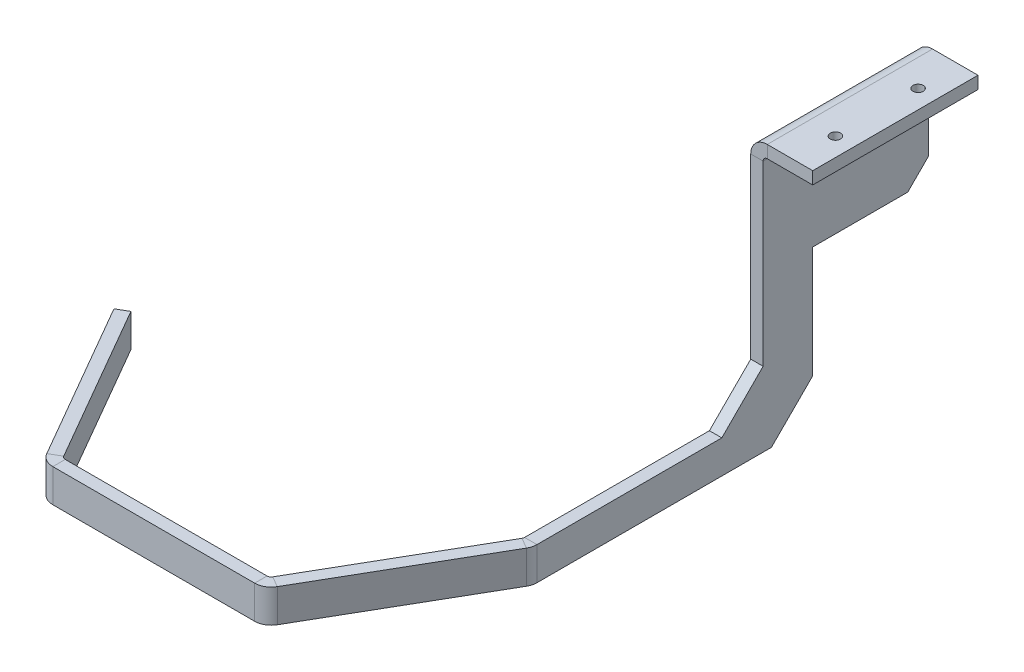
from build123d import *

# Parameters (mm, degrees)
SM_BASE_FLANGE_1_DEPTH           = 40
M3X0_5_1_D                       = 2.5
SKETCH_22_W                      = 3
SKETCH_22_H                      = 12
EXTRUDE_6_DEPTH                  = 29
SKETCH_23_W                      = 3
SKETCH_23_H                      = 67
EXTRUDE_7_DEPTH                  = 8
CHAMFER_1_SIZE                   = 10
CHAMFER_2_SIZE                   = 5
SM_EDGE_FLANGE_1_STRIP_CUT_DEPTH = 8
SM_EDGE_FLANGE_1_DEPTH           = 8
SM_EDGE_FLANGE_2_STRIP_CUT_DEPTH = 8
SM_EDGE_FLANGE_2_DEPTH           = 8
SM_EDGE_FLANGE_3_STRIP_CUT_DEPTH = 8
SM_EDGE_FLANGE_3_DEPTH           = 8


# Sheet-metal steps are written as plain solids
with BuildPart() as part:
    # 草圖3 → 基材-凸緣1 (new body)
    with BuildSketch(Plane.XY):
        with BuildLine():
            Line((12, 0), (1, 0))
            ThreePointArc((1, 0), (0.292893219, -0.292893219), (0, -1))
            Line((0, -1), (0, -25))
            Line((0, -25), (-3, -25))
            Line((-3, -25), (-3, -1))
            ThreePointArc((-3, -1), (-1.828427125, 1.828427125), (1, 3))
            Line((1, 3), (12, 3))
            Line((12, 3), (12, 0))
        make_face()
    extrude(amount=SM_BASE_FLANGE_1_DEPTH)

    # M3x0.5 螺紋孔1 (through all)
    with Locations(Plane(origin=(0, 3, 0), x_dir=(1, 0, 0), z_dir=(0, 1, 0))):
        with Locations((7.5, -30), (7.5, -10)):
            Hole(M3X0_5_1_D / 2)

    # 草圖22 → 填料-伸長6 (add)
    with BuildSketch(Plane.XZ.offset(25)):
        with Locations((-1.5, 34)):
            Rectangle(SKETCH_22_W, SKETCH_22_H)
    extrude(amount=EXTRUDE_6_DEPTH)

    # 草圖23 → 填料-伸長7 (add)
    with BuildSketch(Plane.XZ.offset(54)):
        with Locations((-1.5, 61.5)):
            Rectangle(SKETCH_23_W, SKETCH_23_H)
    extrude(amount=EXTRUDE_7_DEPTH)

    # 導角1
    chamfer_1_edges = [part.edges().sort_by_distance(p)[0] for p in [
        (-1.5, -54, 40),
        (-1.5, -62, 28),
    ]]
    chamfer(chamfer_1_edges, length=CHAMFER_1_SIZE)

    # 導角2
    chamfer_2_edges = [part.edges().sort_by_distance(p)[0] for p in [
        (-1.5, -25, 0),
    ]]
    chamfer(chamfer_2_edges, length=CHAMFER_2_SIZE)

    # 邊線-凸緣1 strip (across the edge) → 邊線-凸緣1 strip cut (cut)
    with BuildSketch(Plane(origin=(-3, -62, 95), x_dir=(-0.8660254037844416, 0, -0.49999999999999495), z_dir=(0, 1, 0))):
        Polygon((-9.464101615, 10.392304845), (-2.464101615, -1.732050808), (0.133974596, -0.232050808), (-6.866025404, 11.892304845), align=None)
    extrude(amount=SM_EDGE_FLANGE_1_STRIP_CUT_DEPTH, mode=Mode.SUBTRACT)

    # 邊線-凸緣1 section (across the edge) → 邊線-凸緣1 (add)
    with BuildSketch(Plane(origin=(-3, -62, 95), x_dir=(-0.8660254037844416, 0, -0.49999999999999495), z_dir=(0, 1, 0))):
        with BuildLine():
            Line((-3, 0.267949192), (-3, 45))
            Line((-3, 45), (0, 45))
            Line((0, 45), (0, 0.267949192))
            ThreePointArc((0, 0.267949192), (0.034074174, 0.009130147), (0.133974596, -0.232050808))
            Line((0.133974596, -0.232050808), (-2.464101615, -1.732050808))
            ThreePointArc((-2.464101615, -1.732050808), (-2.863703305, -0.767326988), (-3, 0.267949192))
        make_face()
    extrude(amount=SM_EDGE_FLANGE_1_DEPTH)

    # 邊線-凸緣2 strip (across the edge) → 邊線-凸緣2 strip cut (cut)
    with BuildSketch(Plane(origin=(-25.5, -62, 133.97114317), x_dir=(0, 0, -1), z_dir=(0, 1, 0))):
        Polygon((-13.124355653, 4.113248654), (-1, -2.886751346), (0.5, -0.288675135), (-11.624355653, 6.711324865), align=None)
    extrude(amount=SM_EDGE_FLANGE_2_STRIP_CUT_DEPTH, mode=Mode.SUBTRACT)

    # 邊線-凸緣2 section (across the edge) → 邊線-凸緣2 (add)
    with BuildSketch(Plane(origin=(-25.5, -62, 133.97114317), x_dir=(0, 0, -1), z_dir=(0, 1, 0))):
        with BuildLine():
            Line((-3, 0.577350269), (-3, 50))
            Line((-3, 50), (0, 50))
            Line((0, 50), (0, 0.577350269))
            ThreePointArc((0, 0.577350269), (0.133974596, 0.077350269), (0.5, -0.288675135))
            Line((0.5, -0.288675135), (-1, -2.886751346))
            ThreePointArc((-1, -2.886751346), (-2.464101615, -1.422649731), (-3, 0.577350269))
        make_face()
    extrude(amount=SM_EDGE_FLANGE_2_DEPTH)

    # 邊線-凸緣3 strip (across the edge) → 邊線-凸緣3 strip cut (cut)
    with BuildSketch(Plane(origin=(-75.5, -62, 133.97114317), x_dir=(0.8660254037844312, 0, -0.5000000000000132), z_dir=(0, 1, 0))):
        Polygon((-13.124355653, 4.113248654), (-1, -2.886751346), (0.5, -0.288675135), (-11.624355653, 6.711324865), align=None)
    extrude(amount=SM_EDGE_FLANGE_3_STRIP_CUT_DEPTH, mode=Mode.SUBTRACT)

    # 邊線-凸緣3 section (across the edge) → 邊線-凸緣3 (add)
    with BuildSketch(Plane(origin=(-75.5, -62, 133.97114317), x_dir=(0.8660254037844312, 0, -0.5000000000000132), z_dir=(0, 1, 0))):
        with BuildLine():
            Line((-3, 0.577350269), (-3, 45))
            Line((-3, 45), (0, 45))
            Line((0, 45), (0, 0.577350269))
            ThreePointArc((0, 0.577350269), (0.133974596, 0.077350269), (0.5, -0.288675135))
            Line((0.5, -0.288675135), (-1, -2.886751346))
            ThreePointArc((-1, -2.886751346), (-2.464101615, -1.422649731), (-3, 0.577350269))
        make_face()
    extrude(amount=SM_EDGE_FLANGE_3_DEPTH)


solid = part.part
